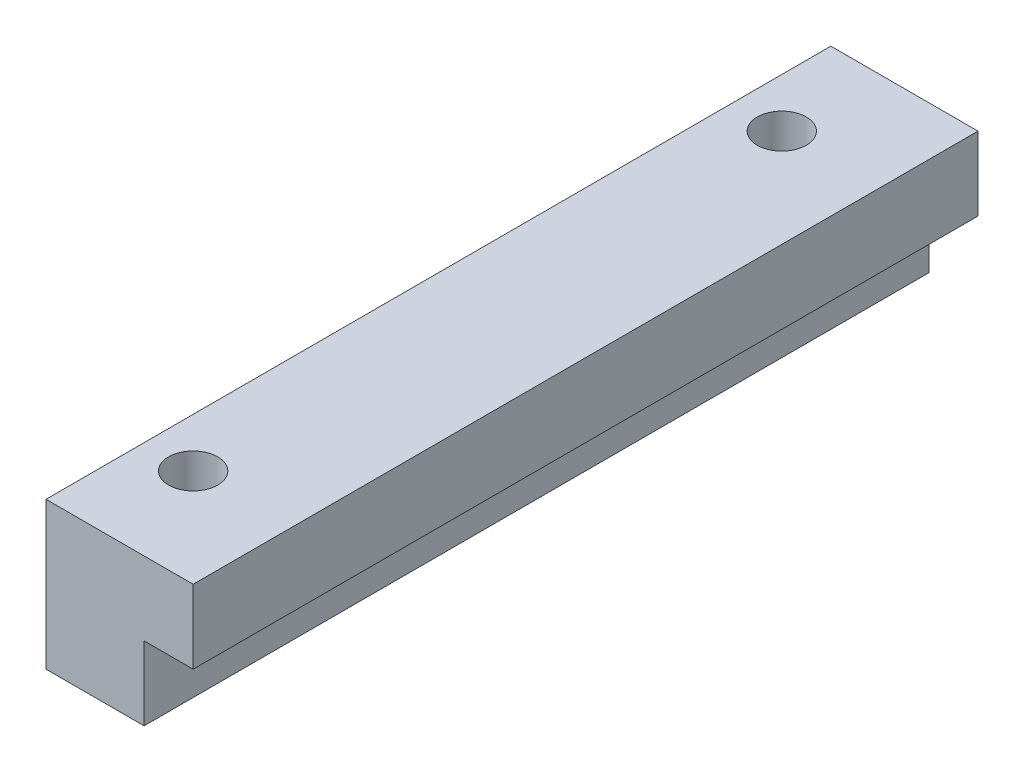
from build123d import *

# Parameters (mm, degrees)
SKETCH1_W                       = 19.05
SKETCH1_H                       = 101.6
BOSS_EXTRUDE1_DEPTH             = 9.525
SKETCH2_W                       = 6.35
SKETCH2_H                       = 9.525
CUT_EXTRUDE1_DEPTH              = 103.489078686
F_1_4_0_25_DIAMETER_HOLE1_D     = 6.35
F_1_4_0_25_DIAMETER_HOLE1_DEPTH = 25.4
F_1_4_0_25_DIAMETER_HOLE1_TIP   = 1.907732465


with BuildPart() as part:
    # Sketch1 → Boss-Extrude1 (new, symmetric)
    with BuildSketch(Plane(origin=(0, 0, 0), x_dir=(1, 0, 0), z_dir=(0, 1, 0))):
        Rectangle(SKETCH1_W, SKETCH1_H)
    extrude(amount=BOSS_EXTRUDE1_DEPTH, both=True)

    # Sketch2 → Cut-Extrude1 (cut, through all)
    with BuildSketch(Plane.XY.offset(50.8)):
        with Locations((6.35, -4.7625)):
            Rectangle(SKETCH2_W, SKETCH2_H)
    extrude(amount=-CUT_EXTRUDE1_DEPTH, mode=Mode.SUBTRACT)

    # 1/4 (0.25) Diameter Hole1
    with Locations(Plane(origin=(0, 9.525, 0), x_dir=(1, 0, 0), z_dir=(0, 1, 0))):
        with Locations((-3.175, 38.1), (-3.175, -38.1)):
            Hole(F_1_4_0_25_DIAMETER_HOLE1_D / 2, depth=F_1_4_0_25_DIAMETER_HOLE1_DEPTH)
            with Locations((0, 0, -(F_1_4_0_25_DIAMETER_HOLE1_DEPTH + F_1_4_0_25_DIAMETER_HOLE1_TIP / 2))):  # 118° drill point
                Cone(0, F_1_4_0_25_DIAMETER_HOLE1_D / 2, F_1_4_0_25_DIAMETER_HOLE1_TIP, mode=Mode.SUBTRACT)


solid = part.part
